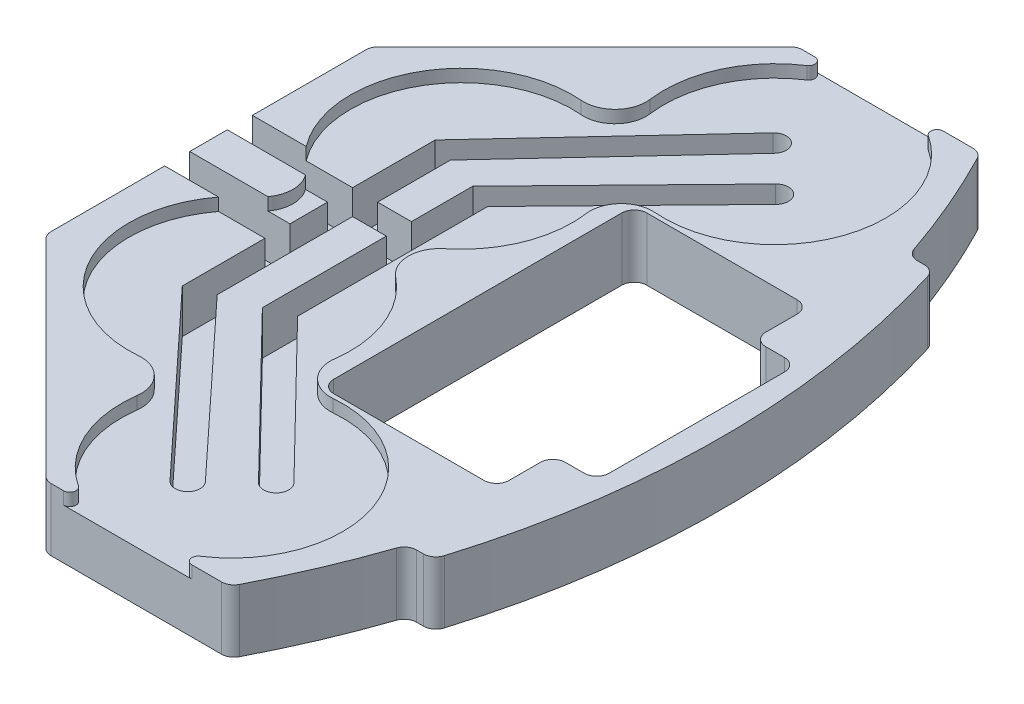
from build123d import *

# Parameters (mm, degrees)
BOSS_EXTRUDE1_DEPTH      = 10
CUT_EXTRUDE4_DEPTH       = 2
FILLET3_R                = 5
FILLET5_R                = 1
CUT_EXTRUDE5_REACH       = 147.341
SKETCH3_W                = 28
SKETCH3_H                = 50
CUT_EXTRUDE8_REACH       = 147.341
SKETCH6_W                = 7
SKETCH6_H                = 32
FILLET4_R                = 2
CUT_EXTRUDE6_DEPTH       = 9
SKETCH5_W                = 25.403463104
SKETCH5_H                = 4
SKETCH5_W_2              = 16.006536896
CUT_EXTRUDE7_DEPTH       = 9
CUT_EXTRUDE10_DEPTH      = 146.340978524
CUT_EXTRUDE10_DEPTH_BACK = 146.340978524
FILLET6_R                = 2


with BuildPart() as part:
    # Sketch1 → Boss-Extrude1 (new body)
    with BuildSketch(Plane(origin=(0, 0, 0), x_dir=(1, 0, 0), z_dir=(0, 1, 0))):
        with BuildLine():
            Line((50, 25.95836944), (84.04163056, 60))
            Line((84.04163056, 60), (117.575507654, 60))
            ThreePointArc((117.575507654, 60), (128.343225396, 30.854764541), (132, 0))
            Line((132, 0), (50, 0))
            Line((50, 0), (50, 25.95836944))
        make_face()
    boss_extrude1 = extrude(amount=BOSS_EXTRUDE1_DEPTH)

    # Sketch2 → Cut-Extrude4 (cut)
    with BuildSketch(Plane(origin=(0, 10, 0), x_dir=(1, 0, 0), z_dir=(0, 1, 0))):
        with BuildLine():
            ThreePointArc((85.205505809, 30.238117065), (109.295165413, 56.187671014), (84.595641082, 30.817914456))
            ThreePointArc((84.595641082, 30.817914456), (56.263418534, 24.268213142), (72.28425661, 0))
            Line((72.28425661, 0), (73.12574339, 0))
            ThreePointArc((73.12574339, 0), (89.146581466, 11.131786858), (85.205505809, 30.238117065))
        make_face()
    cut_extrude4 = extrude(amount=-CUT_EXTRUDE4_DEPTH, mode=Mode.SUBTRACT)

    # Mirror2: Boss-Extrude1, Cut-Extrude4 across plane
    add(boss_extrude1.mirror(Plane.XY))
    add(cut_extrude4.mirror(Plane.XY), mode=Mode.SUBTRACT)

    # Fillet3
    fillet3_edges = [part.edges().sort_by_distance(p)[0] for p in [
        (84.595641082, 9, 30.817914456),
        (85.205505809, 9, 30.238117065),
        (73.12574339, 9, 0),
        (72.28425661, 9, 0),
        (85.205505809, 9, -30.238117065),
        (84.595641082, 9, -30.817914456),
    ]]
    fillet(fillet3_edges, radius=FILLET3_R)

    # Fillet5
    fillet5_edges = [part.edges().sort_by_distance(p)[0] for p in [
        (103.133144343, 9, 60),
        (91.059149438, 9, 60),
        (103.133144343, 9, -60),
        (91.059149438, 9, -60),
    ]]
    fillet(fillet5_edges, radius=FILLET5_R)

    # Sketch3 → Cut-Extrude5 (cut, up to next)
    with BuildSketch(Plane(origin=(0, 10, 0), x_dir=(1, 0, 0), z_dir=(0, 1, 0)), mode=Mode.PRIVATE) as cut_extrude5_sk1:
        with Locations((107, 0)):
            Rectangle(SKETCH3_W, SKETCH3_H)
    cut_extrude5_tool1 = extrude(cut_extrude5_sk1.sketch, amount=-CUT_EXTRUDE5_REACH, mode=Mode.PRIVATE) & part.part
    add(cut_extrude5_tool1.solids().sort_by_distance((107, 10, 0))[0], mode=Mode.SUBTRACT)

    # Sketch6 → Cut-Extrude8 (cut, up to next)
    with BuildSketch(Plane(origin=(0, 10, 0), x_dir=(1, 0, 0), z_dir=(0, 1, 0)), mode=Mode.PRIVATE) as cut_extrude8_sk1:
        with Locations((124.5, 0)):
            Rectangle(SKETCH6_W, SKETCH6_H)
    cut_extrude8_tool1 = extrude(cut_extrude8_sk1.sketch, amount=-CUT_EXTRUDE8_REACH, mode=Mode.PRIVATE) & part.part
    add(cut_extrude8_tool1.solids().sort_by_distance((124.5, 10, 0))[0], mode=Mode.SUBTRACT)

    # Fillet4
    fillet4_edges = [part.edges().sort_by_distance(p)[0] for p in [
        (121, 5, 25),
        (93, 5, 25),
        (121, 5, -25),
        (93, 5, -25),
        (121, 5, 16),
        (128, 5, 16),
        (121, 5, -16),
        (128, 5, -16),
    ]]
    fillet(fillet4_edges, radius=FILLET4_R)

    # Sketch4 → Cut-Extrude6 (cut)
    with BuildSketch(Plane(origin=(0, 10, 0), x_dir=(1, 0, 0), z_dir=(0, 1, 0))):
        with BuildLine():
            Line((92.007663365, 48.162911495), (66.006536896, 20.196190696))
            Line((66.006536896, 20.196190696), (66.006536896, -20.196190696))
            Line((66.006536896, -20.196190696), (92.007663365, -48.162911495))
            ThreePointArc((92.007663365, -48.162911495), (94.834216355, -48.265859024), (94.937163885, -45.439306034))
            Line((94.937163885, -45.439306034), (70.006536896, -18.624010737))
            Line((70.006536896, -18.624010737), (70.006536896, 18.624010737))
            Line((70.006536896, 18.624010737), (94.937163885, 45.439306034))
            ThreePointArc((94.937163885, 45.439306034), (94.834216355, 48.265859024), (92.007663365, 48.162911495))
        make_face()
        with BuildLine():
            Line((102.152078281, -38.514956951), (79.403463104, -15.176427989))
            Line((79.403463104, -15.176427989), (79.403463104, 15.176427989))
            Line((79.403463104, 15.176427989), (102.152078281, 38.514956951))
            ThreePointArc((102.152078281, 38.514956951), (102.115877481, 41.343152401), (99.287682031, 41.306951601))
            Line((99.287682031, 41.306951601), (75.403463104, 16.803370577))
            Line((75.403463104, 16.803370577), (75.403463104, -16.803370577))
            Line((75.403463104, -16.803370577), (99.287682031, -41.306951601))
            ThreePointArc((99.287682031, -41.306951601), (102.115877481, -41.343152401), (102.152078281, -38.514956951))
        make_face()
    extrude(amount=-CUT_EXTRUDE6_DEPTH, mode=Mode.SUBTRACT)

    # Sketch5 → Cut-Extrude7 (cut)
    with BuildSketch(Plane(origin=(0, 10, 0), x_dir=(1, 0, 0), z_dir=(0, 1, 0))):
        with Locations((62.701731552, 5)):
            Rectangle(SKETCH5_W, SKETCH5_H)
        with Locations((58.003268448, -5)):
            Rectangle(SKETCH5_W_2, SKETCH5_H)
    extrude(amount=-CUT_EXTRUDE7_DEPTH, mode=Mode.SUBTRACT)

    # Sketch8 → Cut-Extrude10 (cut, two sides: drawn at the far end of the back side and taken through both)
    with BuildSketch(Plane(origin=(0, 10, 0), x_dir=(1, 0, 0), z_dir=(0, 1, 0)).offset(-CUT_EXTRUDE10_DEPTH_BACK)):
        with BuildLine():
            Line((-18.38866412, 308.613750384), (113.285710253, 60))
            ThreePointArc((113.285710253, 60), (117.964217475, 50.180629162), (121.793481548, 40))
            Line((121.793481548, 40), (125.793481548, 40))
            ThreePointArc((125.793481548, 40), (132, 0), (125.793481548, -40))
            Line((125.793481548, -40), (121.793481548, -40))
            ThreePointArc((121.793481548, -40), (117.964217475, -50.180629162), (113.285710253, -60))
            Line((113.285710253, -60), (-18.38866412, -308.613750384))
            Line((-18.38866412, -308.613750384), (544.27264696, -308.613750384))
            Line((544.27264696, -308.613750384), (544.27264696, 308.613750384))
            Line((544.27264696, 308.613750384), (-18.38866412, 308.613750384))
        make_face()
    extrude(amount=CUT_EXTRUDE10_DEPTH + CUT_EXTRUDE10_DEPTH_BACK, mode=Mode.SUBTRACT)

    # Fillet6
    fillet6_edges = [part.edges().sort_by_distance(p)[0] for p in [
        (84.04163056, 5, 60),
        (50, 5, 25.95836944),
        (50, 5, -25.95836944),
        (84.04163056, 5, -60),
        (113.285710253, 5, -60),
        (121.793481548, 5, -40),
        (125.793481548, 5, -40),
        (121.793481548, 5, 40),
        (125.793481548, 5, 40),
        (113.285710253, 5, 60),
    ]]
    fillet(fillet6_edges, radius=FILLET6_R)


solid = part.part
